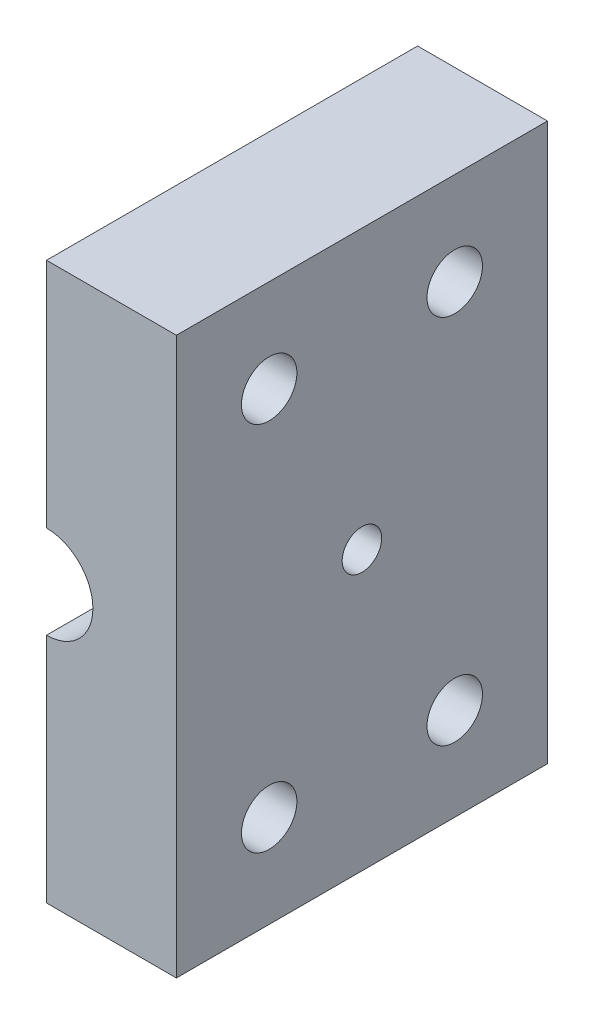
from build123d import *

# Parameters (mm, degrees)
SKETCH1_W             = 8.89
SKETCH1_H             = 25.4
BOSS_EXTRUDE1_DEPTH   = 12.7
SKETCH2_R             = 3.175
CUT_EXTRUDE1_DEPTH    = 25.4
F_6_CLEARANCE_HOLE2_D = 3.7973
F_6_32_TAPPED_HOLE1_D = 2.7051


with BuildPart() as part:
    # Sketch1 → Boss-Extrude1 (new, symmetric)
    with BuildSketch(Plane.XY):
        Rectangle(SKETCH1_W, SKETCH1_H)
    boss_extrude1 = extrude(amount=BOSS_EXTRUDE1_DEPTH, both=True)

    # Sketch2 → Cut-Extrude1 (cut)
    with BuildSketch(Plane.XY.offset(12.7)):
        with Locations((-4.445, -6.35)):
            Circle(SKETCH2_R)
    cut_extrude1 = extrude(amount=-CUT_EXTRUDE1_DEPTH, mode=Mode.SUBTRACT)

    # #6 Clearance Hole2 (through all)
    with Locations(Plane(origin=(4.445, 0, 0), x_dir=(0, 0, -1), z_dir=(1, 0, 0))):
        with Locations((-6.35, 6.35), (6.35, 6.35)):
            f_6_clearance_hole2 = Hole(F_6_CLEARANCE_HOLE2_D / 2)

    # #6-32 Tapped Hole1 (through all)
    with Locations(Plane(origin=(4.445, 0, 0), x_dir=(0, 0, -1), z_dir=(1, 0, 0))):
        with Locations((0, -6.35)):
            f_6_32_tapped_hole1 = Hole(F_6_32_TAPPED_HOLE1_D / 2)

    # Mirror1: Boss-Extrude1, Cut-Extrude1, #6 Clearance Hole2, #6-32 Tapped Hole1 across plane
    add(boss_extrude1.mirror(Plane.ZX.offset(-6.349943242)))
    add(cut_extrude1.mirror(Plane.ZX.offset(-6.349943242)), mode=Mode.SUBTRACT)
    add(f_6_clearance_hole2.mirror(Plane.ZX.offset(-6.349943242)), mode=Mode.SUBTRACT)
    add(f_6_32_tapped_hole1.mirror(Plane.ZX.offset(-6.349943242)), mode=Mode.SUBTRACT)


solid = part.part
